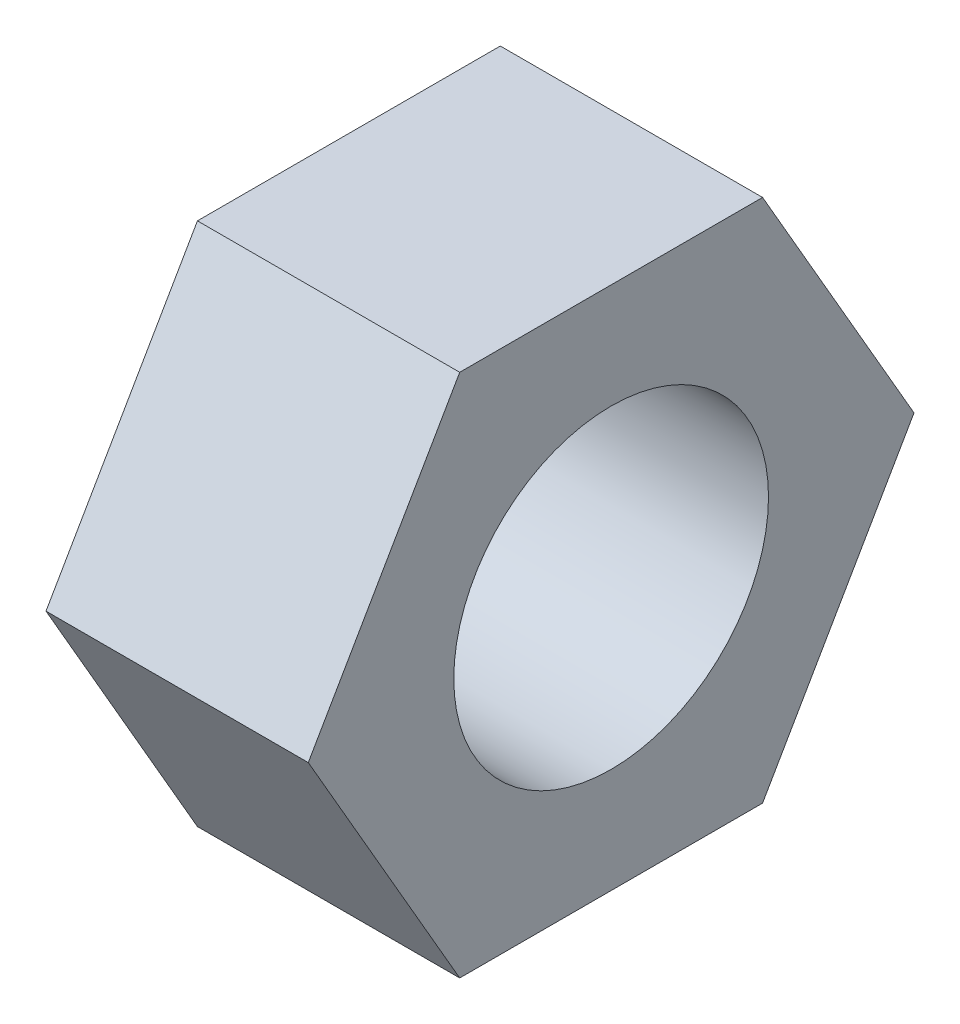
from build123d import *

# Parameters (mm, degrees)
NUT_DEPTH       = 5
THREAD_SKETCH_W = 7
THREAD_SKETCH_H = 3


with BuildPart() as part:
    # Nut Sketch → Nut (new body)
    with BuildSketch(Plane(origin=(0, 0, 0), x_dir=(0, 0, -1), z_dir=(1, 0, 0))):
        Polygon((5.773502692, 0), (2.886751346, 5), (-2.886751346, 5), (-5.773502692, 0), (-2.886751346, -5), (2.886751346, -5), align=None)
    extrude(amount=NUT_DEPTH)

    # Thread Sketch → Thread (revolve, cut)
    with BuildSketch(Plane.XY):
        with Locations((2.5, 1.5)):
            Rectangle(THREAD_SKETCH_W, THREAD_SKETCH_H)
    revolve(axis=Axis((-1000, 0, 0), (1, 0, 0)), mode=Mode.SUBTRACT)


solid = part.part
